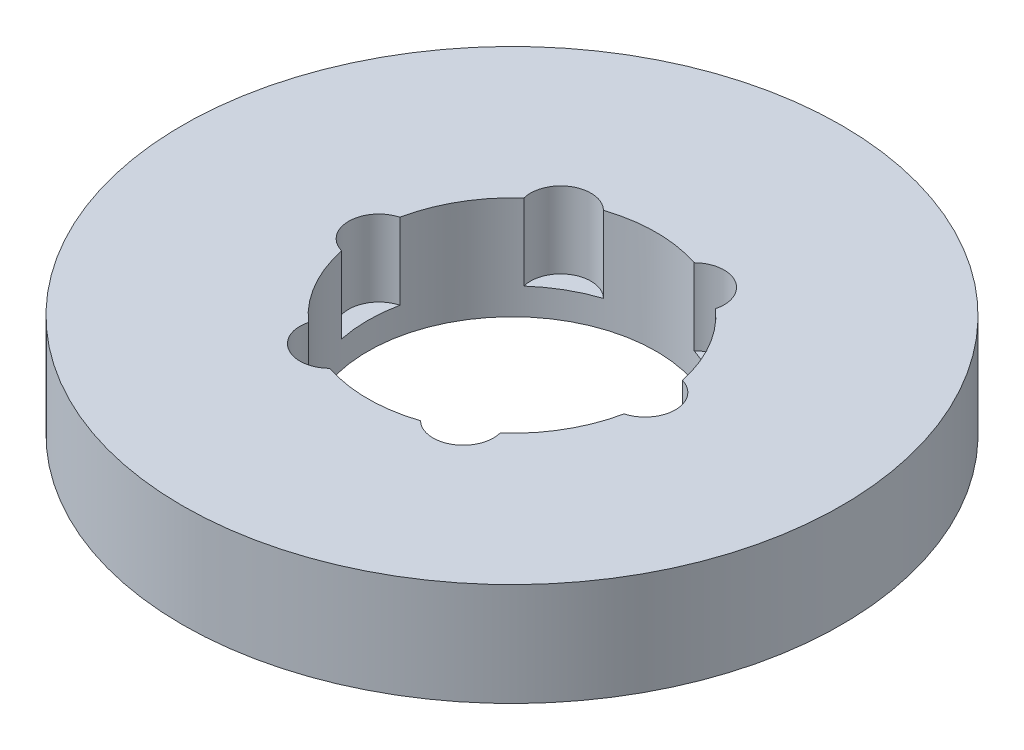
from build123d import *

# Parameters (mm, degrees)
SKETCH1_R           = 80
BOSS_EXTRUDE1_DEPTH = 25
SKETCH2_R           = 35
CUT_EXTRUDE1_DEPTH  = 116.866302263
SKETCH3_R           = 7.341137368
CUT_EXTRUDE2_DEPTH  = 18.506501734
CIRPATTERN1_COUNT   = 6


with BuildPart() as part:
    # Sketch1 → Boss-Extrude1 (new body)
    with BuildSketch(Plane(origin=(0, 0, 0), x_dir=(1, 0, 0), z_dir=(0, 1, 0))):
        Circle(SKETCH1_R)
    extrude(amount=BOSS_EXTRUDE1_DEPTH)

    # Sketch2 → Cut-Extrude1 (cut, through all)
    with BuildSketch(Plane(origin=(0, 0, 0), x_dir=(1, 0, 0), z_dir=(0, 1, 0))):
        Circle(SKETCH2_R)
    extrude(amount=CUT_EXTRUDE1_DEPTH, mode=Mode.SUBTRACT)

    # Sketch3 → Cut-Extrude2 (cut)
    with BuildSketch(Plane(origin=(0, 25, 0), x_dir=(1, 0, 0), z_dir=(0, 1, 0))):
        with Locations((-32.313840261, 0)):
            Circle(SKETCH3_R)
    cut_extrude2 = extrude(amount=-CUT_EXTRUDE2_DEPTH, mode=Mode.SUBTRACT)

    # CirPattern1: Cut-Extrude2 ×6 about axis
    cirpattern1_axis = Axis((0, 0, 0), (0, 1, 0))
    for i in range(1, CIRPATTERN1_COUNT):
        add(cut_extrude2.rotate(cirpattern1_axis, i * 360 / CIRPATTERN1_COUNT), mode=Mode.SUBTRACT)


solid = part.part
